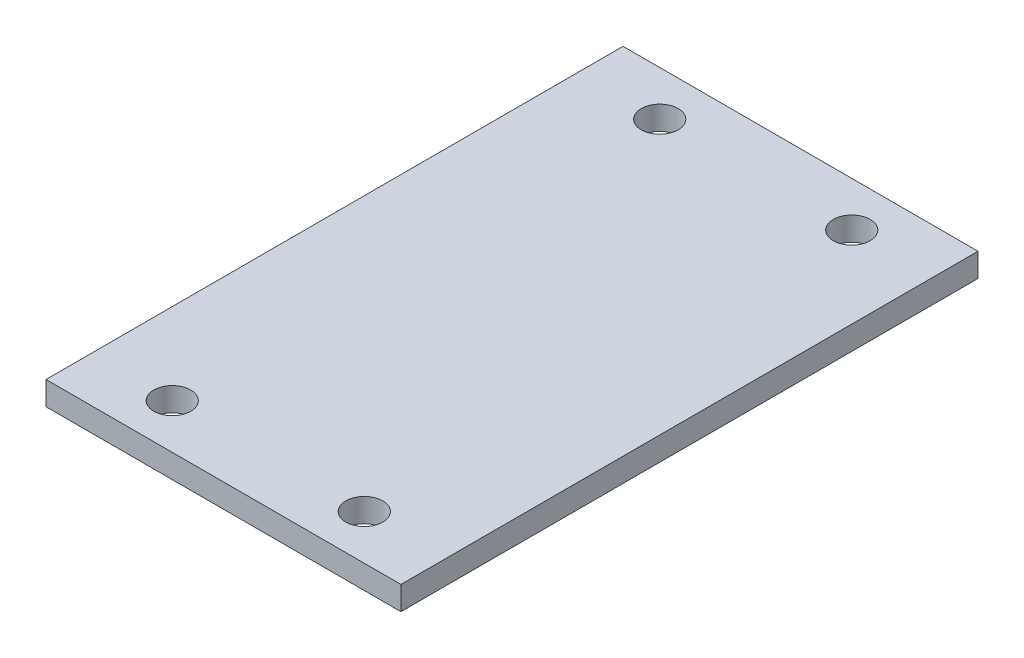
from build123d import *

# Parameters (mm, degrees)
SKETCH1_W           = 24.0284
SKETCH1_H           = 39.0652
SKETCH1_R           = 1.25
BOSS_EXTRUDE1_DEPTH = 1.6


with BuildPart() as part:
    # Sketch1 → Boss-Extrude1 (new body)
    with BuildSketch(Plane(origin=(0, 0, 0), x_dir=(1, 0, 0), z_dir=(0, 1, 0))):
        with Locations((12.0142, 19.5326)):
            Rectangle(SKETCH1_W, SKETCH1_H)
        with Locations((5.5142, 36.0326)):
            Circle(SKETCH1_R, mode=Mode.SUBTRACT)
        with Locations((5.5142, 3.0326)):
            Circle(SKETCH1_R, mode=Mode.SUBTRACT)
        with Locations((18.5142, 36.0326)):
            Circle(SKETCH1_R, mode=Mode.SUBTRACT)
        with Locations((18.5142, 3.0326)):
            Circle(SKETCH1_R, mode=Mode.SUBTRACT)
    extrude(amount=BOSS_EXTRUDE1_DEPTH)


solid = part.part
